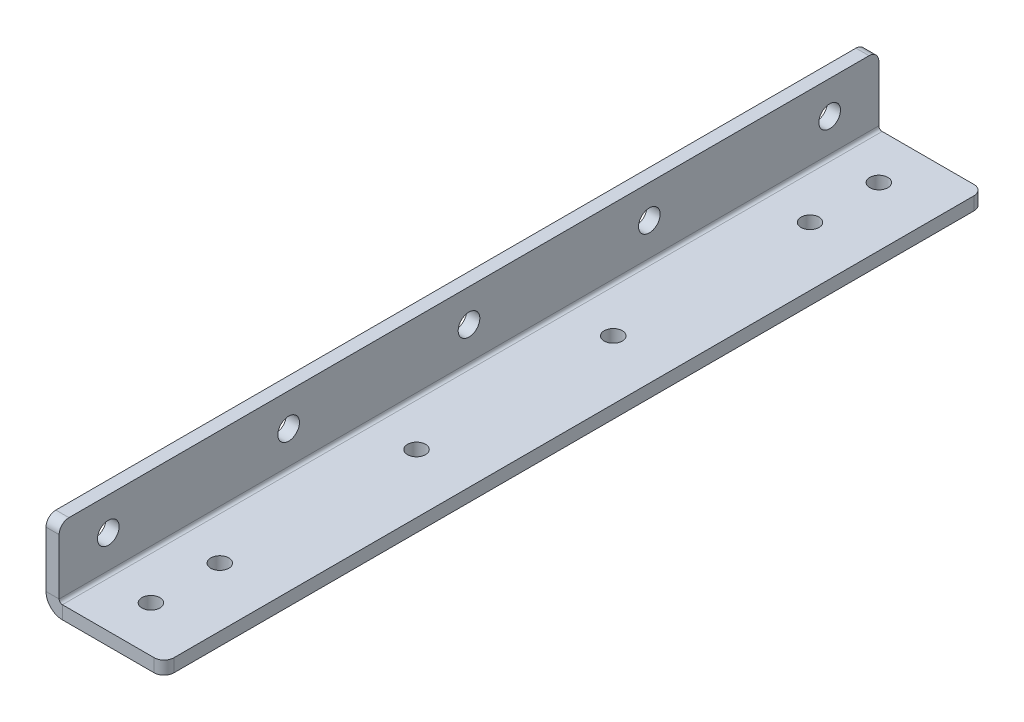
from build123d import *

# Parameters (mm, degrees)
BASE_FLANGE1_START   = -125
BASE_FLANGE1_DEPTH   = 250
FILLET1_R            = 3
M5_CLEARANCE_HOLE1_D = 5.5
M5_CLEARANCE_HOLE2_D = 5.5
M6_CLEARANCE_HOLE1_D = 6.6


# Read off the part's stored shape, not the designer's step: Base-Flange1
with BuildPart() as part:
    # Base-Flange1 outline → Base-Flange1 (new body)
    with BuildSketch(Plane.XY.offset(BASE_FLANGE1_START)):
        with BuildLine():
            Line((5, 0), (36, 0))
            Line((36, 0), (36, 4))
            Line((36, 4), (5, 4))
            ThreePointArc((5, 4), (4.292893219, 4.292893219), (4, 5))
            Line((4, 5), (4, 25))
            Line((4, 25), (0, 25))
            Line((0, 25), (0, 5))
            ThreePointArc((0, 5), (1.464466094, 1.464466094), (5, 0))
        make_face()
    extrude(amount=BASE_FLANGE1_DEPTH)

    # Fillet1
    fillet1_edges = [part.edges().sort_by_distance(p)[0] for p in [
        (2, 25, 125),
        (2, 25, -125),
        (36, 2, 125),
        (36, 2, -125),
    ]]
    fillet(fillet1_edges, radius=FILLET1_R)

    # M5 Clearance Hole1 (through all)
    with Locations(Plane(origin=(0, 4, 0), x_dir=(1, 0, 0), z_dir=(0, 1, 0))):
        with Locations((18, 90), (18, 30), (18, -30), (18, -90)):
            Hole(M5_CLEARANCE_HOLE1_D / 2)

    # M5 Clearance Hole2 (through all)
    with Locations(Plane(origin=(0, 4, 0), x_dir=(1, 0, 0), z_dir=(0, 1, 0))):
        with Locations((18, -111), (18, 111)):
            Hole(M5_CLEARANCE_HOLE2_D / 2)

    # M6 Clearance Hole1 (through all)
    with Locations(Plane(origin=(4, 0, 0), x_dir=(0, 0, -1), z_dir=(1, 0, 0))):
        with Locations((-110, 15), (-55, 15), (0, 15), (55, 15), (110, 15)):
            Hole(M6_CLEARANCE_HOLE1_D / 2)


solid = part.part
